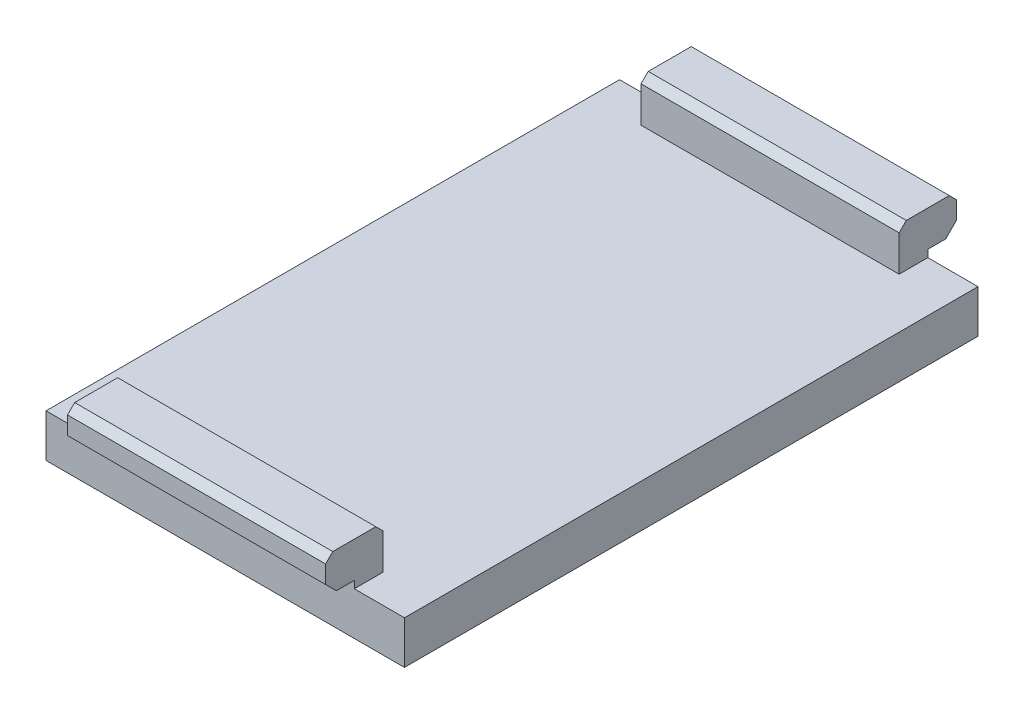
from build123d import *

# Parameters (mm, degrees)
SKETCH_1_W      = 25
SKETCH_1_H      = 3
EXTRUDE_1_DEPTH = 20
SKETCH_2_W      = 18
SKETCH_2_H      = 2
EXTRUDE_2_DEPTH = 3
EXTRUDE_3_DEPTH = 2
CHAMFER_1_SIZE  = 0.75
CHAMFER_2_SIZE  = 0.5
CHAMFER_3_SIZE  = 0.5


with BuildPart() as part:
    # Эскиз1 → Бобышка-Вытянуть1 (new body)
    with BuildSketch(Plane.XY):
        with Locations((-4.579529598, 16.89)):
            Rectangle(SKETCH_1_W, SKETCH_1_H)
    extrude(amount=EXTRUDE_1_DEPTH)

    # Эскиз2 → Бобышка-Вытянуть2 (add)
    with BuildSketch(Plane(origin=(0, 18.39, 0), x_dir=(1, 0, 0), z_dir=(0, 1, 0))):
        with Locations((-4.579529598, -1)):
            Rectangle(SKETCH_2_W, SKETCH_2_H)
    extrude(amount=EXTRUDE_2_DEPTH)

    # Эскиз3 → Бобышка-Вытянуть3 (add)
    with BuildSketch(Plane(origin=(0, 0, 0), x_dir=(-1, 0, 0), z_dir=(0, 0, -1))):
        Polygon((-4.420470402, 21.39), (13.579529598, 21.39), (13.579529598, 19.89), (13.579529598, 18.896471803), (-4.420470402, 18.896471803), (-4.420470402, 19.89), align=None)
    extrude(amount=EXTRUDE_3_DEPTH)

    # Фаска1
    chamfer_1_edges = [part.edges().sort_by_distance(p)[0] for p in [
        (-4.579529598, 18.896471803, -2),
    ]]
    chamfer(chamfer_1_edges, length=CHAMFER_1_SIZE)

    # Фаска2
    chamfer_2_edges = [part.edges().sort_by_distance(p)[0] for p in [
        (-4.579529598, 21.39, -2),
    ]]
    chamfer(chamfer_2_edges, length=CHAMFER_2_SIZE)

    # Фаска3
    chamfer_3_edges = [part.edges().sort_by_distance(p)[0] for p in [
        (-4.579529598, 21.39, 2),
    ]]
    chamfer(chamfer_3_edges, length=CHAMFER_3_SIZE)

    # Зеркальное отражение1: part across plane


with BuildPart() as part_1:
    add(part.part)
    add(part.part.mirror(Plane.XY.offset(20)))


solid = part_1.part
